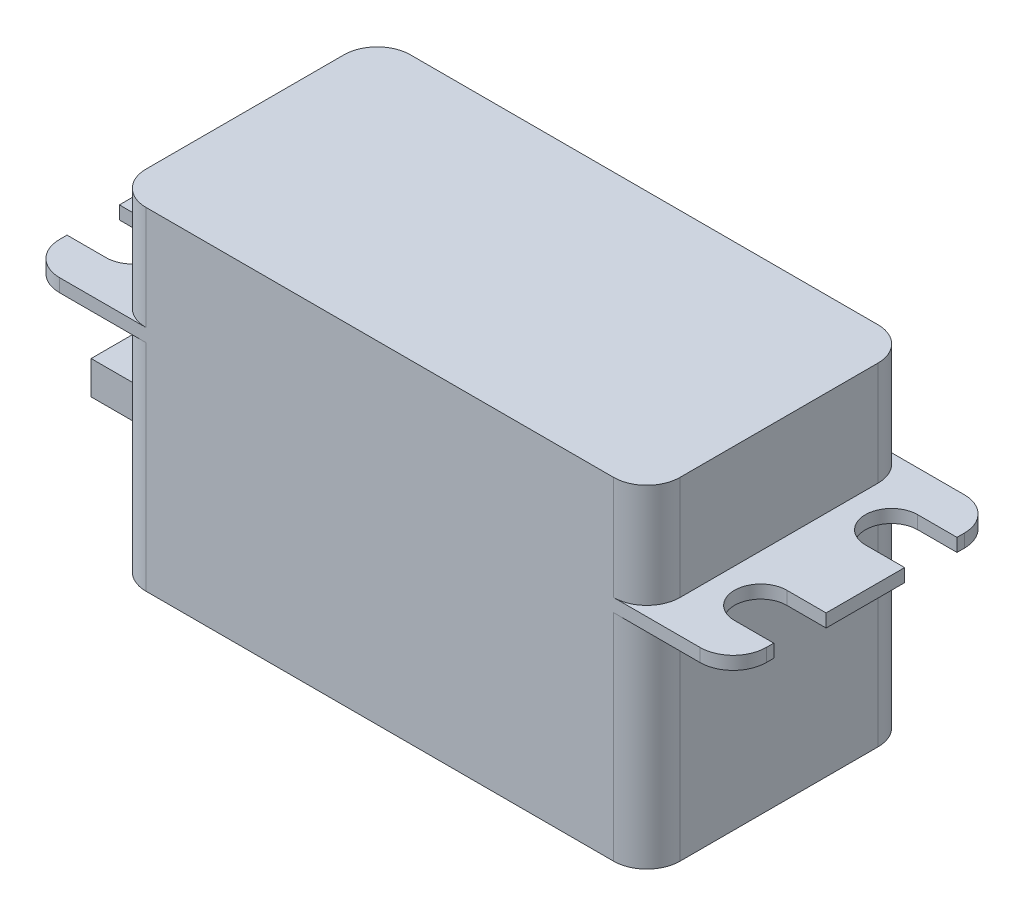
from build123d import *

# Parameters (mm, degrees)
BOSS_EXTRUDE1_DEPTH = 1
BOSS_EXTRUDE2_DEPTH = 7.95
BOSS_EXTRUDE3_START = 16.45
BOSS_EXTRUDE3_DEPTH = 16.45
SKETCH5_W           = 7.62
SKETCH5_H           = 2.54
SKETCH5_W_2         = 1.593312772
SKETCH5_H_2         = 1.697224475
BOSS_EXTRUDE4_DEPTH = 7.62


with BuildPart() as part:
    # Sketch1 → Boss-Extrude1 (new body)
    with BuildSketch(Plane(origin=(0, 0, 0), x_dir=(1, 0, 0), z_dir=(0, 1, 0))):
        with BuildLine():
            ThreePointArc((-27, -7.56), (-26.256051224, -9.356051224), (-24.46, -10.1))
            Line((-24.46, -10.1), (24.46, -10.1))
            ThreePointArc((24.46, -10.1), (26.256051224, -9.356051224), (27, -7.56))
            Line((27, -7.56), (27, -7))
            Line((27, -7), (24, -7))
            ThreePointArc((24, -7), (22, -5), (24, -3))
            Line((24, -3), (27, -3))
            Line((27, -3), (27, 3))
            Line((27, 3), (24, 3))
            ThreePointArc((24, 3), (22, 5), (24, 7))
            Line((24, 7), (27, 7))
            Line((27, 7), (27, 7.56))
            ThreePointArc((27, 7.56), (26.256051224, 9.356051224), (24.46, 10.1))
            Line((24.46, 10.1), (-24.46, 10.1))
            ThreePointArc((-24.46, 10.1), (-26.256051224, 9.356051224), (-27, 7.56))
            Line((-27, 7.56), (-27, 7))
            Line((-27, 7), (-24, 7))
            ThreePointArc((-24, 7), (-22, 5), (-24, 3))
            Line((-24, 3), (-27, 3))
            Line((-27, 3), (-27, -3))
            Line((-27, -3), (-24, -3))
            ThreePointArc((-24, -3), (-22, -5), (-24, -7))
            Line((-24, -7), (-27, -7))
            Line((-27, -7), (-27, -7.56))
        make_face()
    extrude(amount=BOSS_EXTRUDE1_DEPTH)

    # Sketch3 → Boss-Extrude2 (add)
    with BuildSketch(Plane(origin=(0, 1, 0), x_dir=(1, 0, 0), z_dir=(0, 1, 0))):
        with BuildLine():
            Line((-17.86, -10.1), (17.86, -10.1))
            ThreePointArc((17.86, -10.1), (19.656051224, -9.356051224), (20.4, -7.56))
            Line((20.4, -7.56), (20.4, 7.56))
            ThreePointArc((20.4, 7.56), (19.656051224, 9.356051224), (17.86, 10.1))
            Line((17.86, 10.1), (-17.86, 10.1))
            ThreePointArc((-17.86, 10.1), (-19.656051224, 9.356051224), (-20.4, 7.56))
            Line((-20.4, 7.56), (-20.4, -7.56))
            ThreePointArc((-20.4, -7.56), (-19.656051224, -9.356051224), (-17.86, -10.1))
        make_face()
    extrude(amount=BOSS_EXTRUDE2_DEPTH)

    # Sketch4 → Boss-Extrude3 (add)
    with BuildSketch(Plane.XZ.offset(BOSS_EXTRUDE3_START)):
        with BuildLine():
            Line((-17.86, -10.1), (17.86, -10.1))
            ThreePointArc((17.86, -10.1), (19.656051224, -9.356051224), (20.4, -7.56))
            Line((20.4, -7.56), (20.4, 7.56))
            ThreePointArc((20.4, 7.56), (19.656051224, 9.356051224), (17.86, 10.1))
            Line((17.86, 10.1), (-17.86, 10.1))
            ThreePointArc((-17.86, 10.1), (-19.656051224, 9.356051224), (-20.4, 7.56))
            Line((-20.4, 7.56), (-20.4, -7.56))
            ThreePointArc((-20.4, -7.56), (-19.656051224, -9.356051224), (-17.86, -10.1))
        make_face()
    extrude(amount=-BOSS_EXTRUDE3_DEPTH)

    # Sketch5 → Boss-Extrude4 (add)
    with BuildSketch(Plane.ZY.offset(20.4)):
        with Locations((0.328957964, -10.377289394)):
            Rectangle(SKETCH5_W, SKETCH5_H)
        with Locations((0.444447332, -10.417667581)):
            Rectangle(SKETCH5_W_2, SKETCH5_H_2, mode=Mode.SUBTRACT)
        with Locations((-2.095552668, -10.417667581)):
            Rectangle(SKETCH5_W_2, SKETCH5_H_2, mode=Mode.SUBTRACT)
        with Locations((2.984447332, -10.417667581)):
            Rectangle(SKETCH5_W_2, SKETCH5_H_2, mode=Mode.SUBTRACT)
    extrude(amount=BOSS_EXTRUDE4_DEPTH)


solid = part.part
